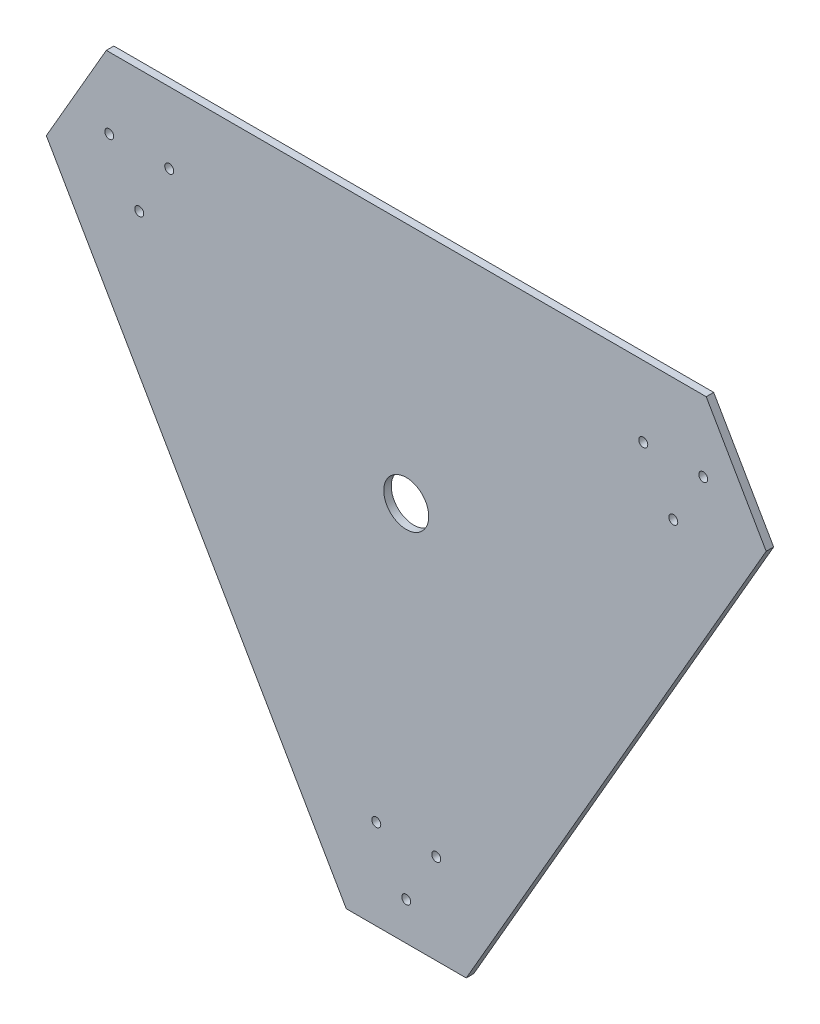
from build123d import *

# Parameters (mm, degrees)
SKETCH_1_R      = 1.5
SKETCH_1_R_2    = 7.5
EXTRUDE_1_DEPTH = 2.5


with BuildPart() as part:
    # Эскиз1 → Бобышка-Вытянуть1 (new body)
    with BuildSketch(Plane.XY):
        Polygon((0, 0), (20, 34.641016151), (220, 34.641016151), (240, 0), (140, -173.205080757), (100, -173.205080757), align=None)
        with Locations((20.98120212, 10.980508076)):
            Circle(SKETCH_1_R, mode=Mode.SUBTRACT)
        with Locations((40.98120212, 10.980508076)):
            Circle(SKETCH_1_R, mode=Mode.SUBTRACT)
        with Locations((30.98120212, -6.34)):
            Circle(SKETCH_1_R, mode=Mode.SUBTRACT)
        with Locations((199.01879788, 10.980508076)):
            Circle(SKETCH_1_R, mode=Mode.SUBTRACT)
        with Locations((219.01879788, 10.980508076)):
            Circle(SKETCH_1_R, mode=Mode.SUBTRACT)
        with Locations((209.01879788, -6.34)):
            Circle(SKETCH_1_R, mode=Mode.SUBTRACT)
        with Locations((110, -143.204572681)):
            Circle(SKETCH_1_R, mode=Mode.SUBTRACT)
        with Locations((130, -143.204572681)):
            Circle(SKETCH_1_R, mode=Mode.SUBTRACT)
        with Locations((120, -160.525080757)):
            Circle(SKETCH_1_R, mode=Mode.SUBTRACT)
        with Locations((120, -46.188021535)):
            Circle(SKETCH_1_R_2, mode=Mode.SUBTRACT)
    extrude(amount=EXTRUDE_1_DEPTH)


solid = part.part
